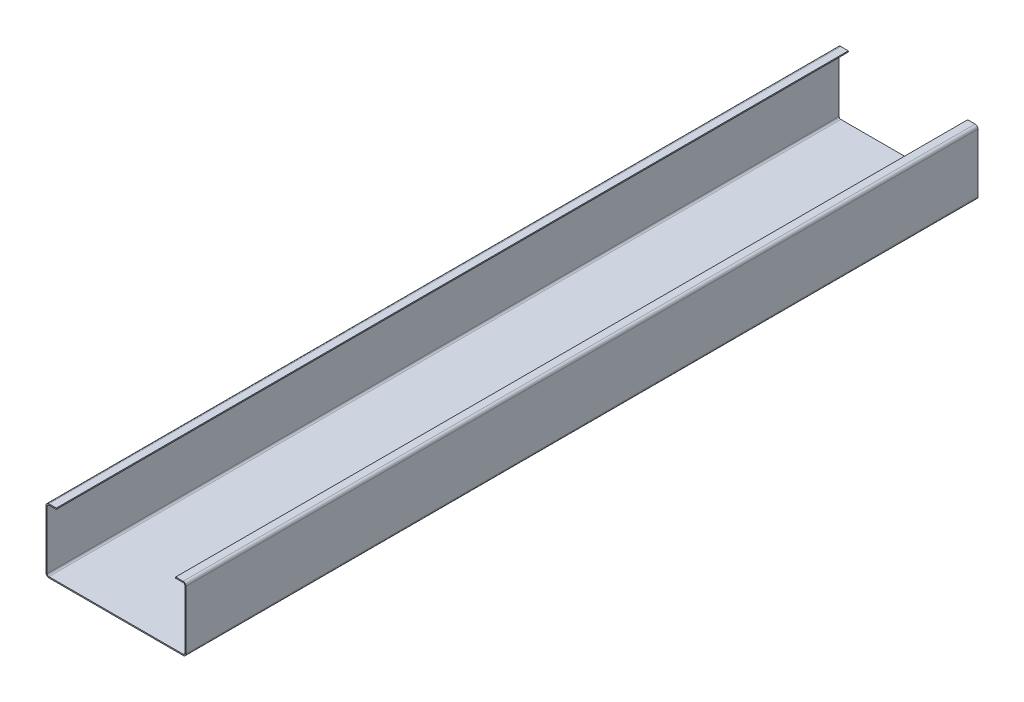
from build123d import *

# Parameters (mm, degrees)
SM_BASE_FLANGE_1_DEPTH = 345


# Sheet-metal steps are written as plain solids
with BuildPart() as part:
    # Sketch 1 → Базовая кромка1 (new body)
    with BuildSketch(Plane.XY):
        with BuildLine():
            Line((-26, 27), (-29.25, 27))
            ThreePointArc((-29.25, 27), (-29.780330086, 26.780330086), (-30, 26.25))
            Line((-30, 26.25), (-30, 0.75))
            ThreePointArc((-30, 0.75), (-29.780330086, 0.219669914), (-29.25, 0))
            Line((-29.25, 0), (29.25, 0))
            ThreePointArc((29.25, 0), (29.780330086, 0.219669914), (30, 0.75))
            Line((30, 0.75), (30, 26.25))
            ThreePointArc((30, 26.25), (29.780330086, 26.780330086), (29.25, 27))
            Line((29.25, 27), (26, 27))
            Line((26, 27), (26, 27.5))
            Line((26, 27.5), (29.25, 27.5))
            ThreePointArc((29.25, 27.5), (30.133883476, 27.133883476), (30.5, 26.25))
            Line((30.5, 26.25), (30.5, 0.75))
            ThreePointArc((30.5, 0.75), (30.133883476, -0.133883476), (29.25, -0.5))
            Line((29.25, -0.5), (-29.25, -0.5))
            ThreePointArc((-29.25, -0.5), (-30.133883476, -0.133883476), (-30.5, 0.75))
            Line((-30.5, 0.75), (-30.5, 26.25))
            ThreePointArc((-30.5, 26.25), (-30.133883476, 27.133883476), (-29.25, 27.5))
            Line((-29.25, 27.5), (-26, 27.5))
            Line((-26, 27.5), (-26, 27))
        make_face()
    extrude(amount=-SM_BASE_FLANGE_1_DEPTH)


solid = part.part
